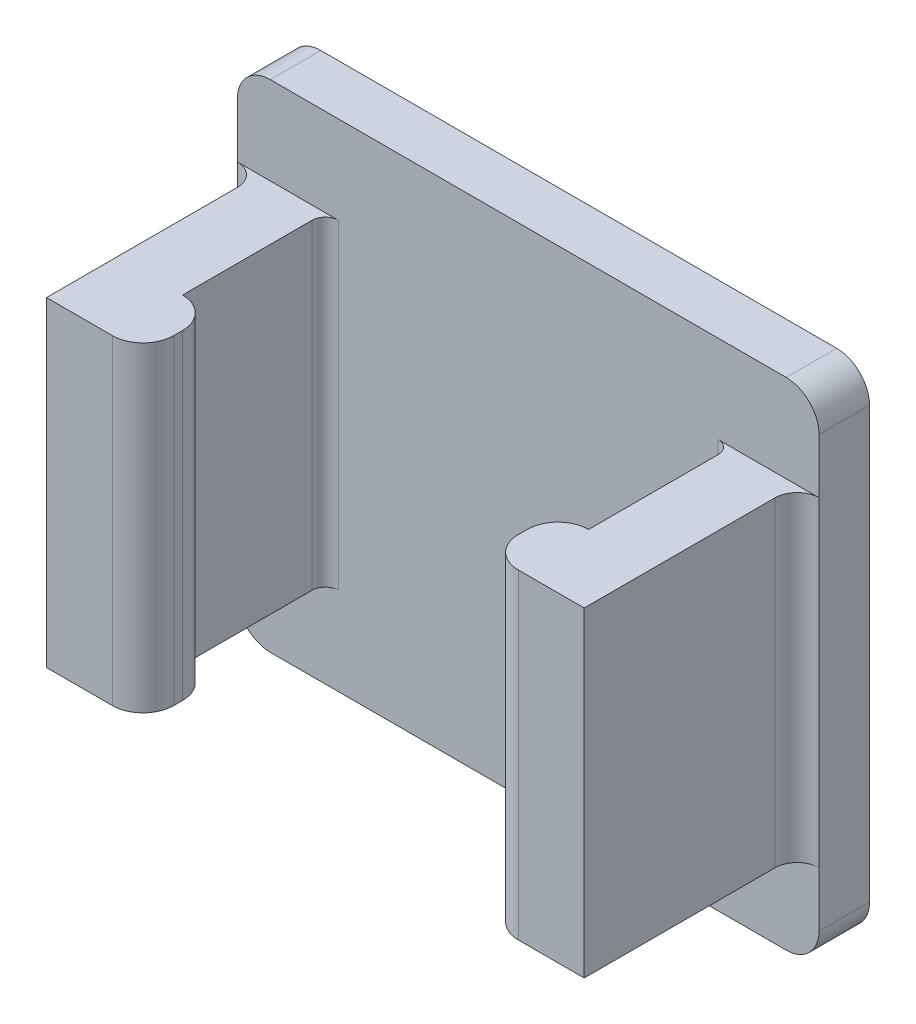
from build123d import *

# Parameters (mm, degrees)
SKETCH_1_W          = 12.25
SKETCH_1_H          = 11.3
EXTRUDE_1_DEPTH     = 2.15
SKETCH_2_W          = 1.5
SKETCH_2_H          = 11.3
EXTRUDE_2_DEPTH     = 3.85
SKETCH_5_W          = 9.25
SKETCH_5_H          = 11.5
CUT_EXTRUDE_1_DEPTH = 1
SKETCH_8_W          = 1.6
SKETCH_8_H          = 11.3
EXTRUDE_5_DEPTH     = 0.7
SKETCH_9_W          = 1.6
SKETCH_9_H          = 11.3
EXTRUDE_6_DEPTH     = 0.7
FILLET_8_R          = 0.3
SKETCH_11_W         = 12.25
SKETCH_11_H         = 4.85
CUT_EXTRUDE_2_DEPTH = 2
SKETCH_12_W         = 12.25
SKETCH_12_H         = 4.85
CUT_EXTRUDE_3_DEPTH = 2
SKETCH_13_W         = 1.15
SKETCH_13_H         = 11.3
EXTRUDE_7_DEPTH     = 0.5
SKETCH_14_W         = 1.15
SKETCH_14_H         = 11.3
EXTRUDE_8_DEPTH     = 0.5
FILLET_9_R          = 0.5
FILLET_10_R         = 0.7
FILLET_11_R         = 0.75


with BuildPart() as part:
    # 스케치1 → 보스-돌출1 (new body)
    with BuildSketch(Plane.XY):
        Rectangle(SKETCH_1_W, SKETCH_1_H)
    extrude(amount=EXTRUDE_1_DEPTH)

    # 스케치2 → 보스-돌출2 (add)
    with BuildSketch(Plane.XY.offset(2.15)):
        with Locations((-5.375, 0)):
            Rectangle(SKETCH_2_W, SKETCH_2_H)
        with Locations((5.375, 0)):
            Rectangle(SKETCH_2_W, SKETCH_2_H)
    extrude(amount=EXTRUDE_2_DEPTH)

    # 스케치5 → 컷-돌출1 (cut)
    with BuildSketch(Plane.XY.offset(2.15)):
        Rectangle(SKETCH_5_W, SKETCH_5_H)
    extrude(amount=-CUT_EXTRUDE_1_DEPTH, mode=Mode.SUBTRACT)

    # 스케치8 → 보스-돌출5 (add)
    with BuildSketch(Plane(origin=(-4.625, 0, 0), x_dir=(0, 0, -1), z_dir=(1, 0, 0))):
        with Locations((-5.2, 0)):
            Rectangle(SKETCH_8_W, SKETCH_8_H)
    extrude(amount=EXTRUDE_5_DEPTH)

    # 스케치9 → 보스-돌출6 (add)
    with BuildSketch(Plane.ZY.offset(-4.625)):
        with Locations((5.2, 0)):
            Rectangle(SKETCH_9_W, SKETCH_9_H)
    extrude(amount=EXTRUDE_6_DEPTH)

    # 필렛8
    fillet_8_edges = [part.edges().sort_by_distance(p)[0] for p in [
        (4.625, 0, 1.15),
        (-4.625, 0, 1.15),
    ]]
    fillet(fillet_8_edges, radius=FILLET_8_R)

    # 스케치11 → 컷-돌출2 (cut)
    with BuildSketch(Plane(origin=(0, 5.65, 0), x_dir=(1, 0, 0), z_dir=(0, 1, 0))):
        with Locations((0, -3.575)):
            Rectangle(SKETCH_11_W, SKETCH_11_H)
    extrude(amount=-CUT_EXTRUDE_2_DEPTH, mode=Mode.SUBTRACT)

    # 스케치12 → 컷-돌출3 (cut)
    with BuildSketch(Plane.XZ.offset(5.65)):
        with Locations((0, 3.575)):
            Rectangle(SKETCH_12_W, SKETCH_12_H)
    extrude(amount=-CUT_EXTRUDE_3_DEPTH, mode=Mode.SUBTRACT)

    # 스케치13 → 보스-돌출7 (add)
    with BuildSketch(Plane(origin=(6.125, 0, 0), x_dir=(0, 0, -1), z_dir=(1, 0, 0))):
        with Locations((-0.575, 0)):
            Rectangle(SKETCH_13_W, SKETCH_13_H)
    extrude(amount=EXTRUDE_7_DEPTH)

    # 스케치14 → 보스-돌출8 (add)
    with BuildSketch(Plane.ZY.offset(6.125)):
        with Locations((0.575, 0)):
            Rectangle(SKETCH_14_W, SKETCH_14_H)
    extrude(amount=EXTRUDE_8_DEPTH)

    # 필렛9
    fillet_9_edges = [part.edges().sort_by_distance(p)[0] for p in [
        (6.125, 0, 1.15),
        (-6.125, 0, 1.15),
    ]]
    fillet(fillet_9_edges, radius=FILLET_9_R - 0.0001)  # a hair under: the kernel refuses the full size

    # 필렛10
    fillet_10_edges = [part.edges().sort_by_distance(p)[0] for p in [
        (-3.925, 0, 6),
        (-3.925, 0, 4.4),
        (3.925, 0, 4.4),
        (3.925, 0, 6),
    ]]
    fillet(fillet_10_edges, radius=FILLET_10_R - 0.0001)  # a hair under: the kernel refuses the full size

    # 필렛11
    fillet_11_edges = [part.edges().sort_by_distance(p)[0] for p in [
        (6.625, -5.65, 0.575),
        (6.625, 5.65, 0.575),
        (-6.625, 5.65, 0.575),
        (-6.625, -5.65, 0.575),
    ]]
    fillet(fillet_11_edges, radius=FILLET_11_R)


solid = part.part
